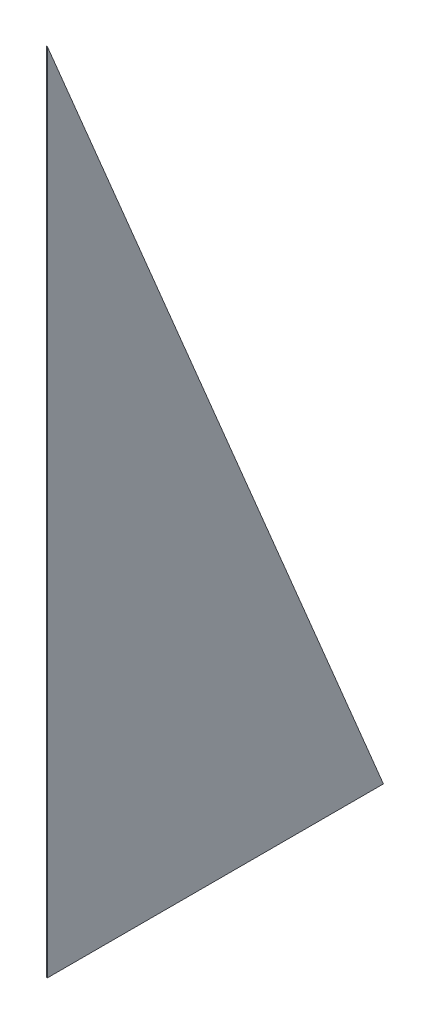
from build123d import *

# Parameters (mm, degrees)
BOSS_EXTRUDE1_DEPTH = 1


with BuildPart() as part:
    # Sketch1 → Boss-Extrude1 (new body)
    with BuildSketch(Plane(origin=(0, 0, 0), x_dir=(0, 0, -1), z_dir=(1, 0, 0))):
        Polygon((0, 0), (0, 1200), (500, 0), align=None)
    extrude(amount=BOSS_EXTRUDE1_DEPTH)


solid = part.part
